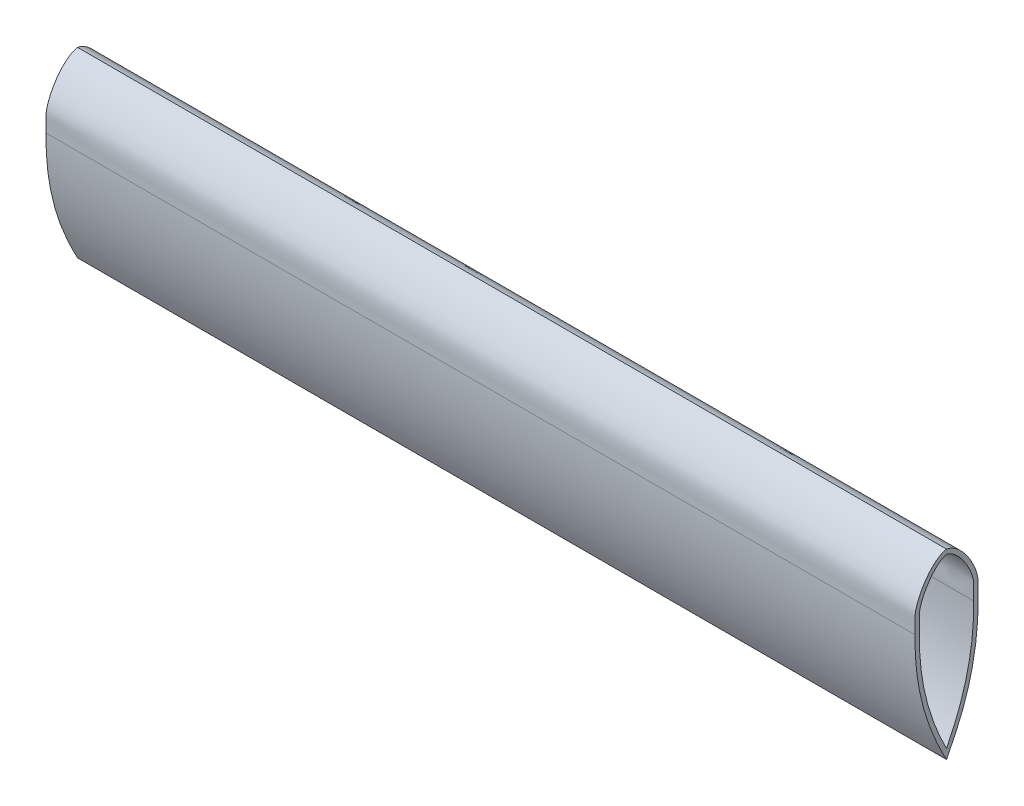
from build123d import *

# Parameters (mm, degrees)
BOSS_EXTRUDE1_DEPTH      = 153.61996
BOSS_EXTRUDE1_DEPTH_BACK = 104.21574
SKETCH1_R                = 7.9375
SKETCH1_R_2              = 6.4643
EXTRUDE_THIN1_START      = -254
EXTRUDE_THIN1_DEPTH      = 254


# Read off the part's stored shape, not the designer's step: Extrude-Thin1
with BuildPart() as part:
    # Sketch1 → Boss-Extrude1 (new, two sides: drawn at the far end of the back side and taken through both)
    with BuildSketch(Plane(origin=(0, 0, 0), x_dir=(0, 0, -1), z_dir=(1, 0, 0)).offset(-BOSS_EXTRUDE1_DEPTH_BACK)):
        with Locations(Location((0, 0, 0), (0, 0, 270))):
            Circle(SKETCH1_R)
        with Locations(Location((0, 0, 0), (0, 0, 270))):
            Circle(SKETCH1_R_2, mode=Mode.SUBTRACT)
    extrude(amount=BOSS_EXTRUDE1_DEPTH + BOSS_EXTRUDE1_DEPTH_BACK)


with BuildPart() as body_2:
    # Extrude-Thin1 outline → Extrude-Thin1 (new body)
    with BuildSketch(Plane(origin=(153.619959862, 0, 0), x_dir=(0, 0, -1), z_dir=(1, 0, 0)).offset(EXTRUDE_THIN1_START)):
        with BuildLine():
            add(Edge.make_bspline(
                [(0, 17.207559546), (-0.213797016, 17.152862004), (-0.42880706, 17.100801803), (-0.845636753, 16.968003101), (-1.049002351, 16.890625775), (-1.646041309, 16.630103699), (-2.026757553, 16.418787844), (-2.577500677, 16.057610271), (-2.758298236, 15.929264249), (-3.108894312, 15.662943804), (-3.279121061, 15.524761589), (-3.776732023, 15.097272706), (-4.091162254, 14.795137978), (-4.692872976, 14.163982702), (-4.980096404, 13.834905644), (-5.531572182, 13.154003751), (-5.79630298, 12.801295822), (-6.549823619, 11.726851467), (-7.002537116, 10.985157901), (-7.81841744, 9.455950062), (-8.182458905, 8.668883339), (-8.640371405, 7.443177376), (-8.778488758, 7.025596822), (-9.009083778, 6.173827929), (-9.100109427, 5.746682632), (-9.20377314, 4.888320037), (-9.211792234, 4.456862798), (-9.198956322, 3.592448397), (-9.189105956, 3.160062893), (-9.172251023, 1.863565908), (-9.176084553, 1.000017435), (-9.207156149, 0.137883897)],
                knots=[0, 0, 0, 0, 0.03125, 0.03125, 0.0625, 0.0625, 0.125, 0.125, 0.15625, 0.15625, 0.1875, 0.1875, 0.25, 0.25, 0.3125, 0.3125, 0.375, 0.375, 0.5, 0.5, 0.625, 0.625, 0.6875, 0.6875, 0.75, 0.75, 0.8125, 0.8125, 0.875, 0.875, 1, 1, 1, 1], degree=3))
            add(Edge.make_bspline(
                [(-9.207156149, 0.137883897), (-9.254567879, -3.016061968), (-9.110594057, -6.162643619), (-8.569736414, -10.862643519), (-8.336275013, -12.419752076), (-7.761375356, -15.514560805), (-7.419573925, -17.053624435), (-6.234254823, -21.632621497), (-5.234488958, -24.618892113), (-3.451071682, -29.000286622), (-2.811540258, -30.439512737), (-1.79028171, -32.569146175), (-1.438672145, -33.273749518), (-0.719336072, -34.675359425), (-0.359668036, -35.376164378), (0, -36.076969332)],
                knots=[0, 0, 0, 0, 0.25, 0.25, 0.375, 0.375, 0.5, 0.5, 0.75, 0.75, 0.875, 0.875, 0.9375, 0.9375, 1, 1, 1, 1], degree=3))
            add(Edge.make_bspline(
                [(0, -36.076969332), (0.359723472, -35.376056363), (0.719446944, -34.675143394), (1.438893888, -33.273317456), (1.790565857, -32.568572444), (2.812063227, -30.438384557), (3.452048995, -28.998025839), (4.640936279, -26.076956924), (5.18815569, -24.600410118), (6.182841679, -21.613493253), (6.630656344, -20.101718647), (7.815624895, -15.522775449), (8.389928975, -12.426265441), (9.11075463, -6.160134365), (9.254567065, -3.016007792), (9.207156149, 0.137883897)],
                knots=[0, 0, 0, 0, 0.0625, 0.0625, 0.125, 0.125, 0.25, 0.25, 0.375, 0.375, 0.5, 0.5, 0.75, 0.75, 1, 1, 1, 1], degree=3))
            add(Edge.make_bspline(
                [(9.207156149, 0.137883897), (9.175689476, 1.0109795), (9.172233827, 1.884590619), (9.189718729, 3.195424485), (9.200223759, 3.632455178), (9.211783508, 4.50634264), (9.200702397, 4.942976061), (9.116060671, 5.596674351), (9.077545633, 5.814621094), (8.98673913, 6.242698466), (8.934293247, 6.453967929), (8.760718275, 7.081391667), (8.623619453, 7.491266508), (8.167045839, 8.703087673), (7.803203601, 9.487588343), (7.187490205, 10.636834402), (6.969553739, 11.016052248), (6.513571235, 11.757163338), (6.275223658, 12.119743306), (5.527228859, 13.18210628), (4.98589787, 13.857489095), (4.084483233, 14.801700924), (3.767120438, 15.10608301), (3.105568901, 15.673289405), (2.760825125, 15.937099293), (2.216615083, 16.294420145), (2.030666021, 16.407085609), (1.648130786, 16.617343262), (1.450611941, 16.715328905), (1.048088593, 16.891075907), (0.843382437, 16.968818509), (0.426225712, 17.101525866), (0.212641899, 17.153157527), (0, 17.207559546)],
                knots=[0, 0, 0, 0, 0.125, 0.125, 0.1875, 0.1875, 0.25, 0.25, 0.28125, 0.28125, 0.3125, 0.3125, 0.375, 0.375, 0.5, 0.5, 0.5625, 0.5625, 0.625, 0.625, 0.75, 0.75, 0.8125, 0.8125, 0.875, 0.875, 0.90625, 0.90625, 0.9375, 0.9375, 0.96875, 0.96875, 1, 1, 1, 1], degree=3))
        make_face()
        with BuildLine():
            add(Edge.make_bspline(
                [(-7.9375, 0.105464983), (-8.117600633, -11.875275839), (-5.466290217, -22.644593383), (0, -33.295535017)],
                knots=[0, 0, 0, 0, 1, 1, 1, 1], degree=3))
            add(Edge.make_bspline(
                [(0, 15.896655346), (-3.804147623, 14.923407312), (-7.989029069, 7.547083002), (-7.925930538, 3.33473819), (-7.884513847, 1.575654615), (-7.9375, 0.105464983)],
                knots=[0, 0, 0, 0, 0.663308265, 0.763308265, 1, 1, 1, 1], degree=3))
            add(Edge.make_bspline(
                [(7.9375, 0.105464983), (7.884513847, 1.575654615), (7.925930538, 3.33473819), (7.989029069, 7.547083002), (3.804147623, 14.923407312), (0, 15.896655346)],
                knots=[0, 0, 0, 0, 0.236691735, 0.336691735, 1, 1, 1, 1], degree=3))
            add(Edge.make_bspline(
                [(0, -33.295535017), (5.466290217, -22.644593383), (8.117600633, -11.875275839), (7.9375, 0.105464983)],
                knots=[0, 0, 0, 0, 1, 1, 1, 1], degree=3))
        make_face(mode=Mode.SUBTRACT)
    extrude(amount=EXTRUDE_THIN1_DEPTH)


solid = body_2.part
